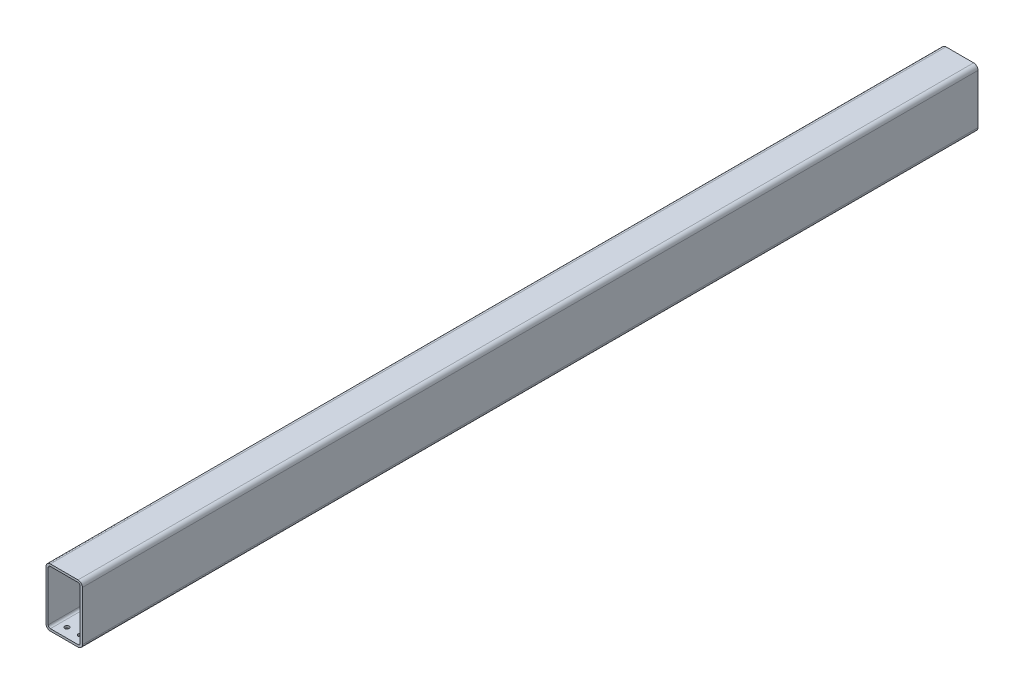
from build123d import *

# Parameters (mm, degrees)
BOSS_EXTRUDE4_DEPTH = 615
SKETCH10_R          = 3
CUT_EXTRUDE6_DEPTH  = 20


with BuildPart() as part:
    # Sketch9 → Boss-Extrude4 (new, symmetric)
    with BuildSketch(Plane.XY):
        with BuildLine():
            Line((19, 40), (-19, 40))
            ThreePointArc((-19, 40), (-23.242640687, 38.242640687), (-25, 34))
            Line((-25, 34), (-25, -34))
            ThreePointArc((-25, -34), (-23.242640687, -38.242640687), (-19, -40))
            Line((-19, -40), (19, -40))
            ThreePointArc((19, -40), (23.242640687, -38.242640687), (25, -34))
            Line((25, -34), (25, 34))
            ThreePointArc((25, 34), (23.242640687, 38.242640687), (19, 40))
        make_face()
        with BuildLine():
            Line((22, -34), (22, 34))
            ThreePointArc((22, 34), (21.121320344, 36.121320344), (19, 37))
            Line((19, 37), (-19, 37))
            ThreePointArc((-19, 37), (-21.121320344, 36.121320344), (-22, 34))
            Line((-22, 34), (-22, -34))
            ThreePointArc((-22, -34), (-21.121320344, -36.121320344), (-19, -37))
            Line((-19, -37), (19, -37))
            ThreePointArc((19, -37), (21.121320344, -36.121320344), (22, -34))
        make_face(mode=Mode.SUBTRACT)
    extrude(amount=BOSS_EXTRUDE4_DEPTH, both=True)

    # Sketch10 → Cut-Extrude6 (cut)
    with BuildSketch(Plane.XZ.offset(40)):
        with Locations((-9.225, 602)):
            Circle(SKETCH10_R)
        with Locations((9.225, 602)):
            Circle(SKETCH10_R)
        with Locations((9.225, 548)):
            Circle(SKETCH10_R)
        with Locations((-9.225, 548)):
            Circle(SKETCH10_R)
        with Locations((9.225, -548)):
            Circle(SKETCH10_R)
        with Locations((-9.225, -548)):
            Circle(SKETCH10_R)
        with Locations((9.225, -602)):
            Circle(SKETCH10_R)
        with Locations((-9.225, -602)):
            Circle(SKETCH10_R)
    extrude(amount=-CUT_EXTRUDE6_DEPTH, mode=Mode.SUBTRACT)


solid = part.part
